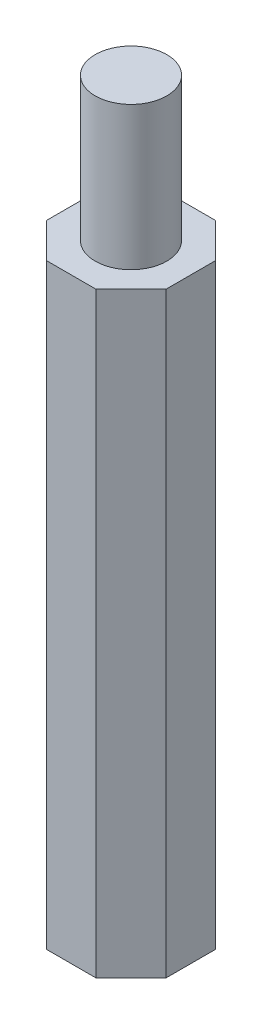
from build123d import *

# Parameters (mm, degrees)
EXTRUSION1_DEPTH        = 12.5
ESQUISSE2_R             = 1.5
EXTRUSION2_DEPTH        = 6
ESQUISSE3_R             = 1.5
ENL_V_MAT_EXTRU_1_DEPTH = 7


with BuildPart() as part:
    # Esquisse1 → Extrusion1 (new, symmetric)
    with BuildSketch(Plane(origin=(0, 0, 0), x_dir=(1, 0, 0), z_dir=(0, 1, 0))):
        Polygon((-1.035533906, 2.5), (1.035533906, 2.5), (2.5, 1.035533906), (2.5, -1.035533906), (1.035533906, -2.5), (-1.035533906, -2.5), (-2.5, -1.035533906), (-2.5, 1.035533906), align=None)
    extrude(amount=EXTRUSION1_DEPTH, both=True)

    # Esquisse2 → Extrusion2 (add)
    with BuildSketch(Plane(origin=(0, 12.5, 0), x_dir=(1, 0, 0), z_dir=(0, 1, 0))):
        Circle(ESQUISSE2_R)
    extrude(amount=EXTRUSION2_DEPTH)

    # Esquisse3 → Enlèv. mat.-Extru.1 (cut)
    with BuildSketch(Plane.XZ.offset(12.5)):
        Circle(ESQUISSE3_R)
    extrude(amount=-ENL_V_MAT_EXTRU_1_DEPTH, mode=Mode.SUBTRACT)


solid = part.part
